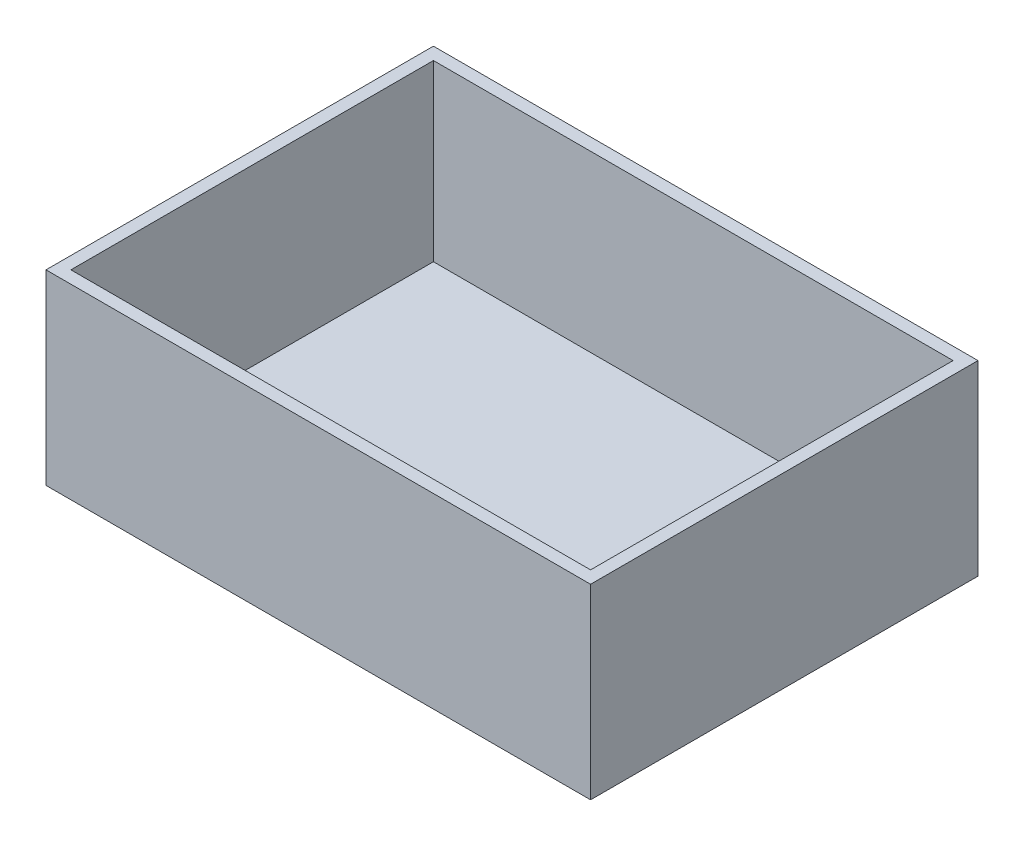
from build123d import *

# Parameters (mm, degrees)
CROQUIS1_W              = 87.5
CROQUIS1_H              = 62.25
SALIENTE_EXTRUIR1_DEPTH = 30
VACIADO1_T              = -2


with BuildPart() as part:
    # Croquis1 → Saliente-Extruir1 (new body)
    with BuildSketch(Plane(origin=(0, 0, 0), x_dir=(1, 0, 0), z_dir=(0, 1, 0))):
        Rectangle(CROQUIS1_W, CROQUIS1_H)
    extrude(amount=SALIENTE_EXTRUIR1_DEPTH)

    # Vaciado1
    vaciado1_openings = [part.faces().sort_by_distance(p)[0] for p in [
        (0, 30, 0),
    ]]
    offset(amount=VACIADO1_T, openings=vaciado1_openings, kind=Kind.INTERSECTION)


solid = part.part
